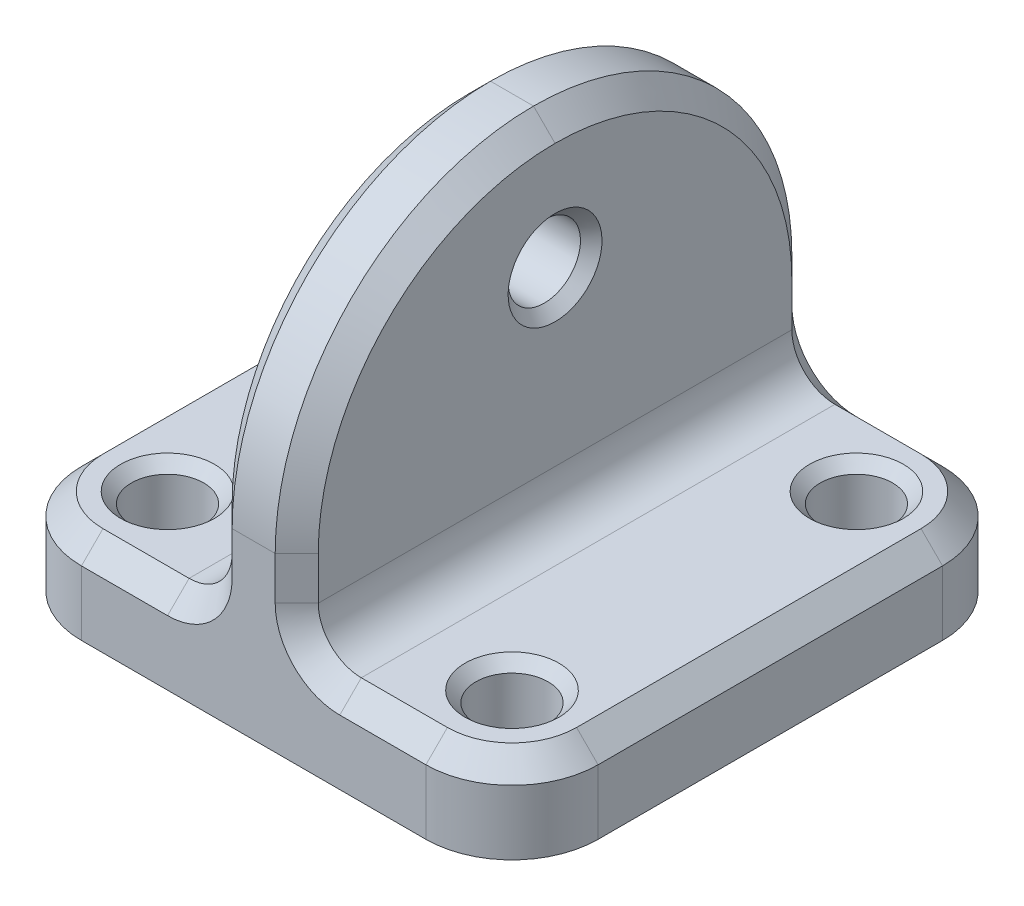
from build123d import *

# Parameters (mm, degrees)
BOSS_EXTRUDE1_DEPTH = 38.1
FILLET1_R           = 19.05
SKETCH2_R           = 2.667
CUT_EXTRUDE1_DEPTH  = 54.127911685
FILLET2_R           = 6.35
SKETCH3_R           = 2.667
CUT_EXTRUDE2_DEPTH  = 55.34724579
FILLET3_R           = 3.175
CHAMFER1_SIZE       = 1.5875
CHAMFER2_SIZE       = 0.79375


with BuildPart() as part:
    # Sketch1 → Boss-Extrude1 (new body)
    with BuildSketch(Plane.XY):
        Polygon((-3.175, 31.75), (3.175, 31.75), (3.175, 6.35), (19.05, 6.35), (19.05, 0), (-19.05, 0), (-19.05, 6.35), (-3.175, 6.35), align=None)
    extrude(amount=BOSS_EXTRUDE1_DEPTH)

    # Fillet1
    fillet1_edges = [part.edges().sort_by_distance(p)[0] for p in [
        (0, 31.75, 0),
        (0, 31.75, 38.1),
    ]]
    fillet(fillet1_edges, radius=FILLET1_R - 0.0001)  # a hair under: the kernel refuses the full size

    # Sketch2 → Cut-Extrude1 (cut, through all)
    with BuildSketch(Plane.XZ):
        with Locations((12.7, 31.75)):
            Circle(SKETCH2_R)
        with Locations((12.7, 6.35)):
            Circle(SKETCH2_R)
        with Locations((-12.7, 6.35)):
            Circle(SKETCH2_R)
        with Locations((-12.7, 31.75)):
            Circle(SKETCH2_R)
    extrude(amount=-CUT_EXTRUDE1_DEPTH, mode=Mode.SUBTRACT)

    # Fillet2
    fillet2_edges = [part.edges().sort_by_distance(p)[0] for p in [
        (19.05, 3.175, 0),
        (-19.05, 3.175, 0),
        (19.05, 3.175, 38.1),
        (-19.05, 3.175, 38.1),
    ]]
    fillet(fillet2_edges, radius=FILLET2_R)

    # Sketch3 → Cut-Extrude2 (cut, through all)
    with BuildSketch(Plane.ZY.offset(3.175)):
        with Locations(Location((19.05, 22.225, 0), (0, 0, 270))):
            Circle(SKETCH3_R)
    extrude(amount=-CUT_EXTRUDE2_DEPTH, mode=Mode.SUBTRACT)

    # Fillet3
    fillet3_edges = [part.edges().sort_by_distance(p)[0] for p in [
        (-3.175, 6.35, 19.05),
        (3.175, 6.35, 19.05),
    ]]
    fillet(fillet3_edges, radius=FILLET3_R)

    # Chamfer1
    chamfer1_edges = [part.edges().sort_by_distance(p)[0] for p in [
        (-3.175, 11.11255, 0),
        (-3.175, 11.11255, 38.1),
        (-3.175, 26.170413471, 32.520413471),
        (-3.175, 26.170413471, 5.579586529),
        (3.175, 26.170413471, 32.520413471),
        (3.175, 26.170413471, 5.579586529),
        (-19.05, 6.35, 19.05),
        (9.525, 6.35, 0),
        (-17.190128061, 6.35, 36.240128061),
        (-17.190128061, 6.35, 1.859871939),
        (19.05, 6.35, 19.05),
        (9.525, 6.35, 38.1),
        (17.190128061, 6.35, 36.240128061),
        (17.190128061, 6.35, 1.859871939),
        (3.175, 11.11255, 0),
        (3.175, 11.11255, 38.1),
        (-9.525, 6.35, 0),
        (-9.525, 6.35, 38.1),
        (4.10493597, 7.27993597, 0),
        (4.10493597, 7.27993597, 38.1),
        (-4.10493597, 7.27993597, 0),
        (-4.10493597, 7.27993597, 38.1),
    ]]
    chamfer(chamfer1_edges, length=CHAMFER1_SIZE)

    # Chamfer2
    chamfer2_edges = [part.edges().sort_by_distance(p)[0] for p in [
        (-15.367, 6.35, 31.75),
        (-15.367, 6.35, 6.35),
        (10.033, 6.35, 6.35),
        (10.033, 6.35, 31.75),
        (3.175, 24.892, 19.05),
        (-3.175, 24.892, 19.05),
    ]]
    chamfer(chamfer2_edges, length=CHAMFER2_SIZE)


solid = part.part
